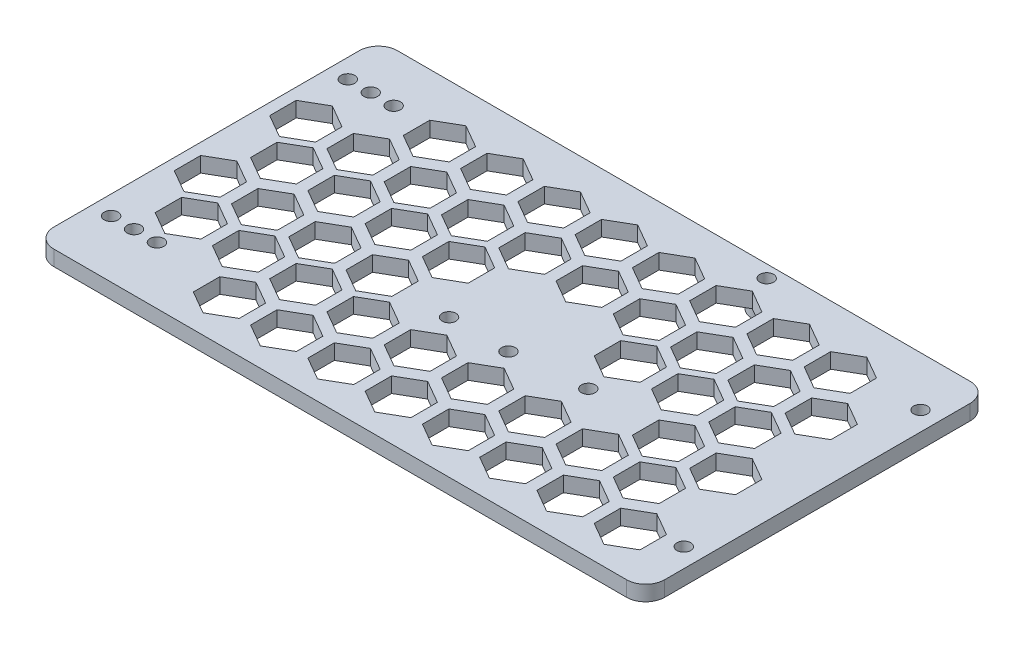
from build123d import *

# Parameters (mm, degrees)
SKETCH1_W           = 160
SKETCH1_H           = 90
SKETCH1_R           = 1.8
BOSS_EXTRUDE1_DEPTH = 4
FILLET1_R           = 5
CUT_EXTRUDE1_DEPTH  = 3
BOSS_EXTRUDE2_START = 3
SKETCH2_R           = 4
SKETCH2_R_2         = 1.8
BOSS_EXTRUDE2_DEPTH = 3
CUT_EXTRUDE2_DEPTH  = 184.619171112


with BuildPart() as part:
    # Sketch1 → Boss-Extrude1 (new body)
    with BuildSketch(Plane(origin=(0, 0, 0), x_dir=(1, 0, 0), z_dir=(0, 1, 0))):
        with Locations((-80, -45)):
            Rectangle(SKETCH1_W, SKETCH1_H)
        with Locations((-155, -75)):
            Circle(SKETCH1_R, mode=Mode.SUBTRACT)
        with Locations((-149, -75)):
            Circle(SKETCH1_R, mode=Mode.SUBTRACT)
        with Locations((-143, -75)):
            Circle(SKETCH1_R, mode=Mode.SUBTRACT)
        with Locations((-5, -75)):
            Circle(SKETCH1_R, mode=Mode.SUBTRACT)
        with Locations((-53.31, -51.7)):
            Circle(SKETCH1_R, mode=Mode.SUBTRACT)
        with Locations((-155, -13)):
            Circle(SKETCH1_R, mode=Mode.SUBTRACT)
        with Locations((-149, -13)):
            Circle(SKETCH1_R, mode=Mode.SUBTRACT)
        with Locations((-143, -13)):
            Circle(SKETCH1_R, mode=Mode.SUBTRACT)
        with Locations((-55.02, -3.27)):
            Circle(SKETCH1_R, mode=Mode.SUBTRACT)
        with Locations((-5, -13)):
            Circle(SKETCH1_R, mode=Mode.SUBTRACT)
        with Locations((-87.78, -53.71)):
            Circle(SKETCH1_R, mode=Mode.SUBTRACT)
        with Locations((-72.22, -53.71)):
            Circle(SKETCH1_R, mode=Mode.SUBTRACT)
    extrude(amount=BOSS_EXTRUDE1_DEPTH)

    # Fillet1
    fillet1_edges = [part.edges().sort_by_distance(p)[0] for p in [
        (-160, 2, 0),
        (0, 2, 0),
        (0, 2, 90),
        (-160, 2, 90),
    ]]
    fillet(fillet1_edges, radius=FILLET1_R)

    # Sketch1<3> → Cut-Extrude1 (cut)
    with BuildSketch(Plane(origin=(0, 0, 0), x_dir=(1, 0, 0), z_dir=(0, 1, 0))):
        with BuildLine():
            Line((-73.251963119, -51.81), (-69.22, -51.81))
            Line((-69.22, -51.81), (-69.22, -38.71))
            Line((-69.22, -38.71), (-90.78, -38.71))
            Line((-90.78, -38.71), (-90.78, -51.81))
            Line((-90.78, -51.81), (-86.748036881, -51.81))
            Line((-86.748036881, -51.81), (-84.718768899, -53.71))
            ThreePointArc((-84.718768899, -53.71), (-85.409760982, -55.647292659), (-87.170790798, -56.71))
            Line((-87.170790798, -56.71), (-72.829209202, -56.71))
            ThreePointArc((-72.829209202, -56.71), (-74.590239018, -55.647292659), (-75.281231101, -53.71))
            Line((-75.281231101, -53.71), (-73.251963119, -51.81))
        make_face()
    extrude(amount=CUT_EXTRUDE1_DEPTH, mode=Mode.SUBTRACT)

    # Sketch2 → Boss-Extrude2 (add)
    # profile 1 of 2: a face of its own
    with BuildSketch(Plane.XZ.offset(BOSS_EXTRUDE2_START)):
        with Locations((-53.31, 51.7)):
            Circle(SKETCH2_R)
        with Locations((-53.31, 51.7)):
            Circle(SKETCH2_R_2, mode=Mode.SUBTRACT)
    # profile 2 of 2: a face of its own
    with BuildSketch(Plane.XZ.offset(BOSS_EXTRUDE2_START)):
        with BuildLine():
            Line((-52.716285608, 0), (-57.323714392, 0))
            ThreePointArc((-57.323714392, 0), (-55.02, 7.27), (-52.716285608, 0))
        make_face()
        with Locations((-55.02, 3.27)):
            Circle(SKETCH2_R_2, mode=Mode.SUBTRACT)
    extrude(amount=-BOSS_EXTRUDE2_DEPTH)

    # Sketch3 → Cut-Extrude2 (cut, through all)
    with BuildSketch(Plane.XZ):
        Polygon((-114.999058955, 24.536441868), (-115.000941193, 31.464644843), (-121.000941193, 34.928746458), (-126.999999852, 31.463014904), (-126.999999852, 24.534811674), (-120.999058955, 21.072340253), align=None)
        Polygon((-123, 11.535898385), (-123, 18.464101615), (-129, 21.92820323), (-135, 18.464101615), (-135, 11.535898385), (-129, 8.07179677), align=None)
        Polygon((-108, 11.535898385), (-108, 18.464101615), (-114, 21.92820323), (-120, 18.464101615), (-120, 11.535898385), (-114, 8.07179677), align=None)
        Polygon((-99.999058955, 24.536441868), (-100.000941193, 31.464644843), (-106.000941193, 34.928746458), (-111.999999852, 31.463014904), (-111.999999852, 24.534811674), (-105.999058955, 21.072340253), align=None)
        Polygon((-93, 11.535898385), (-93, 18.464101615), (-99, 21.92820323), (-105, 18.464101615), (-105, 11.535898385), (-99, 8.07179677), align=None)
        Polygon((-84.999058955, 24.536441868), (-85.000941193, 31.464644843), (-91.000941193, 34.928746458), (-96.999999852, 31.463014904), (-96.999999852, 24.534811674), (-90.999058955, 21.072340253), align=None)
        Polygon((-78, 11.535898385), (-78, 18.464101615), (-84, 21.92820323), (-90, 18.464101615), (-90, 11.535898385), (-84, 8.07179677), align=None)
        Polygon((-69.999058955, 24.536441868), (-70.000941193, 31.464644843), (-76.000941193, 34.928746458), (-81.999999852, 31.463014904), (-81.999999852, 24.534811674), (-75.999058955, 21.072340253), align=None)
        Polygon((-63, 11.535898385), (-63, 18.464101615), (-69, 21.92820323), (-75, 18.464101615), (-75, 11.535898385), (-69, 8.07179677), align=None)
        Polygon((-54.999058955, 24.536441868), (-55.000941193, 31.464644843), (-61.000941193, 34.928746458), (-66.999999852, 31.463014904), (-66.999999852, 24.534811674), (-60.999058955, 21.072340253), align=None)
        Polygon((-48, 11.535898385), (-48, 18.464101615), (-54, 21.92820323), (-60, 18.464101615), (-60, 11.535898385), (-54, 8.07179677), align=None)
        Polygon((-39.999058955, 24.536441868), (-40.000941193, 31.464644843), (-46.000941193, 34.928746458), (-51.999999852, 31.463014904), (-51.999999852, 24.534811674), (-45.999058955, 21.072340253), align=None)
        Polygon((-33, 11.535898385), (-33, 18.464101615), (-39, 21.92820323), (-45, 18.464101615), (-45, 11.535898385), (-39, 8.07179677), align=None)
        Polygon((-24.999058955, 24.536441868), (-25.000941193, 31.464644843), (-31.000941193, 34.928746458), (-36.999999852, 31.463014904), (-36.999999852, 24.534811674), (-30.999058955, 21.072340253), align=None)
        Polygon((-18, 11.535898385), (-18, 18.464101615), (-24, 21.92820323), (-30, 18.464101615), (-30, 11.535898385), (-24, 8.07179677), align=None)
        Polygon((-9.999058955, 24.536441868), (-10.000941193, 31.464644843), (-16.000941193, 34.928746458), (-21.999999852, 31.463014904), (-21.999999852, 24.534811674), (-15.999058955, 21.072340253), align=None)
        Polygon((-108, 36.535898385), (-108, 43.464101615), (-114, 46.92820323), (-120, 43.464101615), (-120, 36.535898385), (-114, 33.07179677), align=None)
        Polygon((-99.999058955, 49.536441868), (-100.000941193, 56.464644843), (-106.000941193, 59.928746458), (-111.999999852, 56.463014904), (-111.999999852, 49.534811674), (-105.999058955, 46.072340253), align=None)
        Polygon((-93, 36.535898385), (-93, 43.464101615), (-99, 46.92820323), (-105, 43.464101615), (-105, 36.535898385), (-99, 33.07179677), align=None)
        Polygon((-48, 36.535898385), (-48, 43.464101615), (-54, 46.92820323), (-60, 43.464101615), (-60, 36.535898385), (-54, 33.07179677), align=None)
        Polygon((-33, 36.535898385), (-33, 43.464101615), (-39, 46.92820323), (-45, 43.464101615), (-45, 36.535898385), (-39, 33.07179677), align=None)
        Polygon((-24.999058955, 49.536441868), (-25.000941193, 56.464644843), (-31.000941193, 59.928746458), (-36.999999852, 56.463014904), (-36.999999852, 49.534811674), (-30.999058955, 46.072340253), align=None)
        Polygon((-18, 36.535898385), (-18, 43.464101615), (-24, 46.92820323), (-30, 43.464101615), (-30, 36.535898385), (-24, 33.07179677), align=None)
        Polygon((-9.999058955, 49.536441868), (-10.000941193, 56.464644843), (-16.000941193, 59.928746458), (-21.999999852, 56.463014904), (-21.999999852, 49.534811674), (-15.999058955, 46.072340253), align=None)
        Polygon((-108, 61.535898385), (-108, 68.464101615), (-114, 71.92820323), (-120, 68.464101615), (-120, 61.535898385), (-114, 58.07179677), align=None)
        Polygon((-99.999058955, 74.536441868), (-100.000941193, 81.464644843), (-106.000941193, 84.928746458), (-111.999999852, 81.463014904), (-111.999999852, 74.534811674), (-105.999058955, 71.072340253), align=None)
        Polygon((-93, 61.535898385), (-93, 68.464101615), (-99, 71.92820323), (-105, 68.464101615), (-105, 61.535898385), (-99, 58.07179677), align=None)
        Polygon((-84.999058955, 74.536441868), (-85.000941193, 81.464644843), (-91.000941193, 84.928746458), (-96.999999852, 81.463014904), (-96.999999852, 74.534811674), (-90.999058955, 71.072340253), align=None)
        Polygon((-78, 61.535898385), (-78, 68.464101615), (-84, 71.92820323), (-90, 68.464101615), (-90, 61.535898385), (-84, 58.07179677), align=None)
        Polygon((-69.999058955, 74.536441868), (-70.000941193, 81.464644843), (-76.000941193, 84.928746458), (-81.999999852, 81.463014904), (-81.999999852, 74.534811674), (-75.999058955, 71.072340253), align=None)
        Polygon((-63, 61.535898385), (-63, 68.464101615), (-69, 71.92820323), (-75, 68.464101615), (-75, 61.535898385), (-69, 58.07179677), align=None)
        Polygon((-54.999058955, 74.536441868), (-55.000941193, 81.464644843), (-61.000941193, 84.928746458), (-66.999999852, 81.463014904), (-66.999999852, 74.534811674), (-60.999058955, 71.072340253), align=None)
        Polygon((-48, 61.535898385), (-48, 68.464101615), (-54, 71.92820323), (-60, 68.464101615), (-60, 61.535898385), (-54, 58.07179677), align=None)
        Polygon((-39.999058955, 74.536441868), (-40.000941193, 81.464644843), (-46.000941193, 84.928746458), (-51.999999852, 81.463014904), (-51.999999852, 74.534811674), (-45.999058955, 71.072340253), align=None)
        Polygon((-33, 61.535898385), (-33, 68.464101615), (-39, 71.92820323), (-45, 68.464101615), (-45, 61.535898385), (-39, 58.07179677), align=None)
        Polygon((-24.999058955, 74.536441868), (-25.000941193, 81.464644843), (-31.000941193, 84.928746458), (-36.999999852, 81.463014904), (-36.999999852, 74.534811674), (-30.999058955, 71.072340253), align=None)
        Polygon((-18, 61.535898385), (-18, 68.464101615), (-24, 71.92820323), (-30, 68.464101615), (-30, 61.535898385), (-24, 58.07179677), align=None)
        Polygon((-9.999058955, 74.536441868), (-10.000941193, 81.464644843), (-16.000941193, 84.928746458), (-21.999999852, 81.463014904), (-21.999999852, 74.534811674), (-15.999058955, 71.072340253), align=None)
        Polygon((-123, 36.535898385), (-123, 43.464101615), (-129, 46.92820323), (-135, 43.464101615), (-135, 36.535898385), (-129, 33.07179677), align=None)
        Polygon((-114.999058955, 49.536441868), (-115.000941193, 56.464644843), (-121.000941193, 59.928746458), (-126.999999852, 56.463014904), (-126.999999852, 49.534811674), (-120.999058955, 46.072340253), align=None)
        Polygon((-123, 61.535898385), (-123, 68.464101615), (-129, 71.92820323), (-135, 68.464101615), (-135, 61.535898385), (-129, 58.07179677), align=None)
        Polygon((-114.999058955, 74.536441868), (-115.000941193, 81.464644843), (-121.000941193, 84.928746458), (-126.999999852, 81.463014904), (-126.999999852, 74.534811674), (-120.999058955, 71.072340253), align=None)
        Polygon((-129.999058955, 24.536441868), (-130.000941193, 31.464644843), (-136.000941193, 34.928746458), (-141.999999852, 31.463014904), (-141.999999852, 24.534811674), (-135.999058955, 21.072340253), align=None)
        Polygon((-138, 36.535898385), (-138, 43.464101615), (-144, 46.92820323), (-150, 43.464101615), (-150, 36.535898385), (-144, 33.07179677), align=None)
        Polygon((-129.999058955, 49.536441868), (-130.000941193, 56.464644843), (-136.000941193, 59.928746458), (-141.999999852, 56.463014904), (-141.999999852, 49.534811674), (-135.999058955, 46.072340253), align=None)
        Polygon((-138, 61.535898385), (-138, 68.464101615), (-144, 71.92820323), (-150, 68.464101615), (-150, 61.535898385), (-144, 58.07179677), align=None)
        Polygon((-144.999058955, 24.536441868), (-145.000941193, 31.464644843), (-151.000941193, 34.928746458), (-156.999999852, 31.463014904), (-156.999999852, 24.534811674), (-150.999058955, 21.072340253), align=None)
        Polygon((-144.999058955, 49.536441868), (-145.000941193, 56.464644843), (-151.000941193, 59.928746458), (-156.999999852, 56.463014904), (-156.999999852, 49.534811674), (-150.999058955, 46.072340253), align=None)
    extrude(amount=-CUT_EXTRUDE2_DEPTH, mode=Mode.SUBTRACT)


solid = part.part
